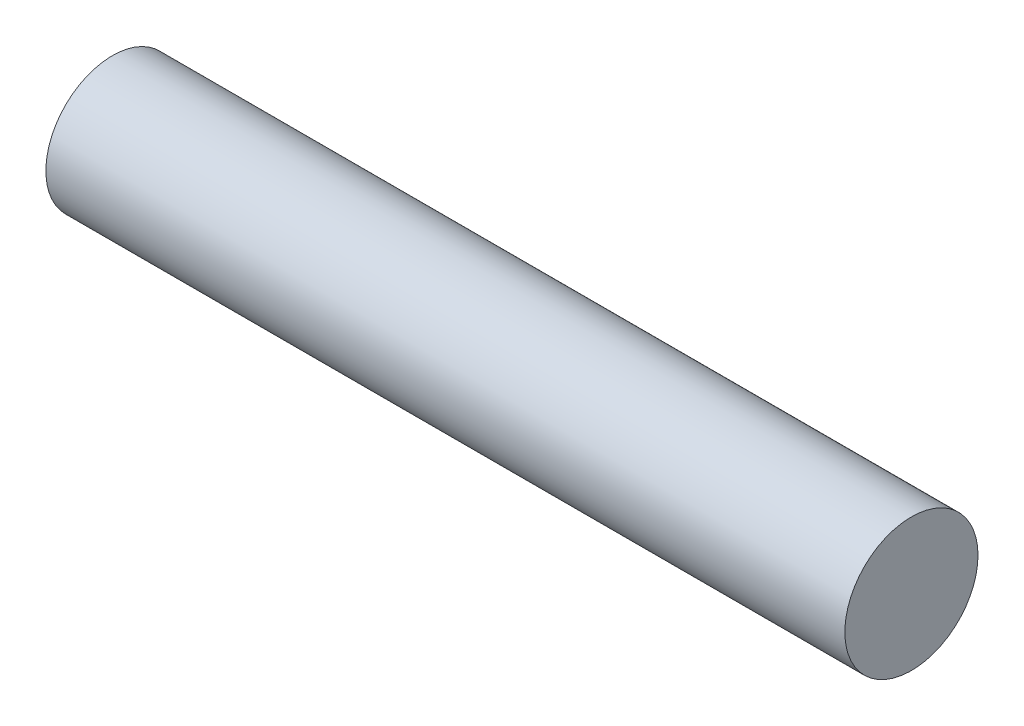
from build123d import *

# Parameters (mm, degrees)
BOSS_EXTRUDE1_DEPTH      = 3
BOSS_EXTRUDE1_DEPTH_BACK = 3
SKETCH1_R                = 0.5


with BuildPart() as part:
    # Sketch1 → Boss-Extrude1 (new, two sides: drawn at the far end of the back side and taken through both)
    with BuildSketch(Plane(origin=(0, 0, 0), x_dir=(0, 0, -1), z_dir=(1, 0, 0)).offset(-BOSS_EXTRUDE1_DEPTH_BACK)):
        Circle(SKETCH1_R)
    extrude(amount=BOSS_EXTRUDE1_DEPTH + BOSS_EXTRUDE1_DEPTH_BACK)


solid = part.part
